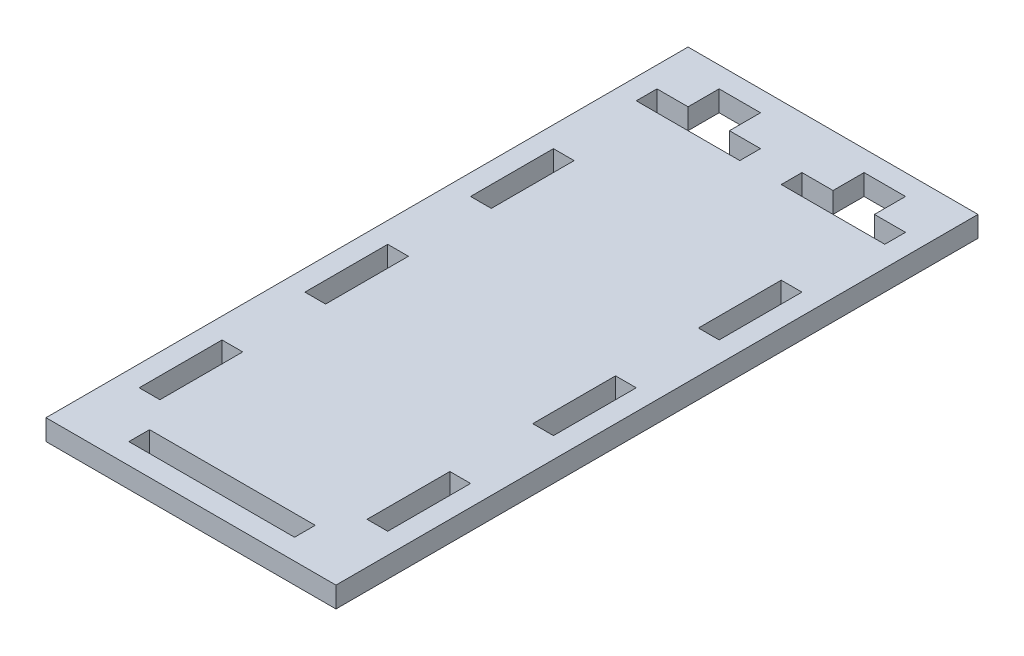
from build123d import *

# Parameters (mm, degrees)
ESQUISSE1_W        = 70
ESQUISSE1_H        = 155
ESQUISSE1_W_2      = 5
ESQUISSE1_H_2      = 20
ESQUISSE1_W_3      = 40
ESQUISSE1_H_3      = 5
BOSS_EXTRU_1_DEPTH = 5


with BuildPart() as part:
    # Esquisse1 → Boss.-Extru.1 (new body)
    with BuildSketch(Plane(origin=(0, 0, 0), x_dir=(1, 0, 0), z_dir=(0, 1, 0))):
        with Locations((0, 5)):
            Rectangle(ESQUISSE1_W, ESQUISSE1_H)
        Polygon((-22.5, 77.5), (-12.5, 77.5), (-12.5, 70), (-5, 70), (-5, 65), (-30, 65), (-30, 70), (-22.5, 70), align=None, mode=Mode.SUBTRACT)
        with Locations((27.5, 35)):
            Rectangle(ESQUISSE1_W_2, ESQUISSE1_H_2, mode=Mode.SUBTRACT)
        with Locations((-27.5, 35)):
            Rectangle(ESQUISSE1_W_2, ESQUISSE1_H_2, mode=Mode.SUBTRACT)
        Polygon((12.5, 77.5), (22.5, 77.5), (22.5, 70), (30, 70), (30, 65), (5, 65), (5, 70), (12.5, 70), align=None, mode=Mode.SUBTRACT)
        with Locations((-27.5, -5)):
            Rectangle(ESQUISSE1_W_2, ESQUISSE1_H_2, mode=Mode.SUBTRACT)
        with Locations((-27.5, -45)):
            Rectangle(ESQUISSE1_W_2, ESQUISSE1_H_2, mode=Mode.SUBTRACT)
        with Locations((27.5, -5)):
            Rectangle(ESQUISSE1_W_2, ESQUISSE1_H_2, mode=Mode.SUBTRACT)
        with Locations((27.5, -45)):
            Rectangle(ESQUISSE1_W_2, ESQUISSE1_H_2, mode=Mode.SUBTRACT)
        with Locations((0, -65)):
            Rectangle(ESQUISSE1_W_3, ESQUISSE1_H_3, mode=Mode.SUBTRACT)
    extrude(amount=BOSS_EXTRU_1_DEPTH)


solid = part.part
